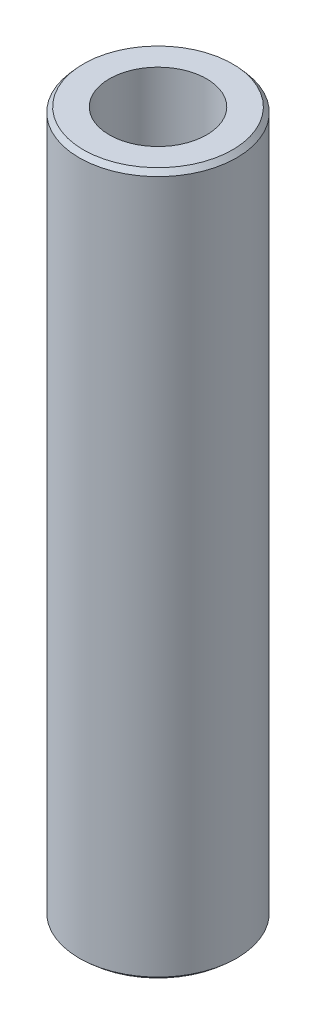
from build123d import *
from OCP.BRepFilletAPI import BRepFilletAPI_MakeChamfer

# Parameters (mm, degrees)
SKETCH1_R           = 15
BOSS_EXTRUDE1_DEPTH = 133.78279768
SKETCH2_R           = 9.266767828
CUT_EXTRUDE1_DEPTH  = 136.454187662
CHAMFER1_SIZE       = 0.913459422
CHAMFER1_SIZE2      = 0.800807564


with BuildPart() as part:
    # Sketch1 → Boss-Extrude1 (new body)
    with BuildSketch(Plane(origin=(0, 0, 0), x_dir=(1, 0, 0), z_dir=(0, 1, 0))):
        Circle(SKETCH1_R)
    extrude(amount=BOSS_EXTRUDE1_DEPTH)

    # Sketch2 → Cut-Extrude1 (cut, through all)
    with BuildSketch(Plane(origin=(0, 0, 0), x_dir=(1, 0, 0), z_dir=(0, 1, 0))):
        Circle(SKETCH2_R)
    extrude(amount=CUT_EXTRUDE1_DEPTH, mode=Mode.SUBTRACT)

    # Chamfer1: one chamfer whose edges measure the first distance from different faces: ONE call of the kernel's chamfer builder (chamfer() names one face for all edges)
    chamfer1_edges_1 = [part.edges().sort_by_distance(p)[0] for p in [
        (-15, 133.78279768, 0),
    ]]
    chamfer1_side_1 = [part.faces().sort_by_distance(p)[0] for p in [
        (-15, 66.89139884, 0),
    ]]
    chamfer1_edges_2 = [part.edges().sort_by_distance(p)[0] for p in [
        (-15, 0, 0),
    ]]
    chamfer1_side_2 = [part.faces().sort_by_distance(p)[0] for p in [
        (-14.575735931, 0, 0),
    ]]
    chamfer1 = BRepFilletAPI_MakeChamfer(part.part.solid().wrapped)
    for e in chamfer1_edges_1:
        chamfer1.Add(CHAMFER1_SIZE, CHAMFER1_SIZE2, e.wrapped, chamfer1_side_1[0].wrapped)  # the first distance lies on this face
    for e in chamfer1_edges_2:
        chamfer1.Add(CHAMFER1_SIZE, CHAMFER1_SIZE2, e.wrapped, chamfer1_side_2[0].wrapped)  # the first distance lies on this face
    add(Compound.cast(chamfer1.Shape()), mode=Mode.REPLACE)


solid = part.part
